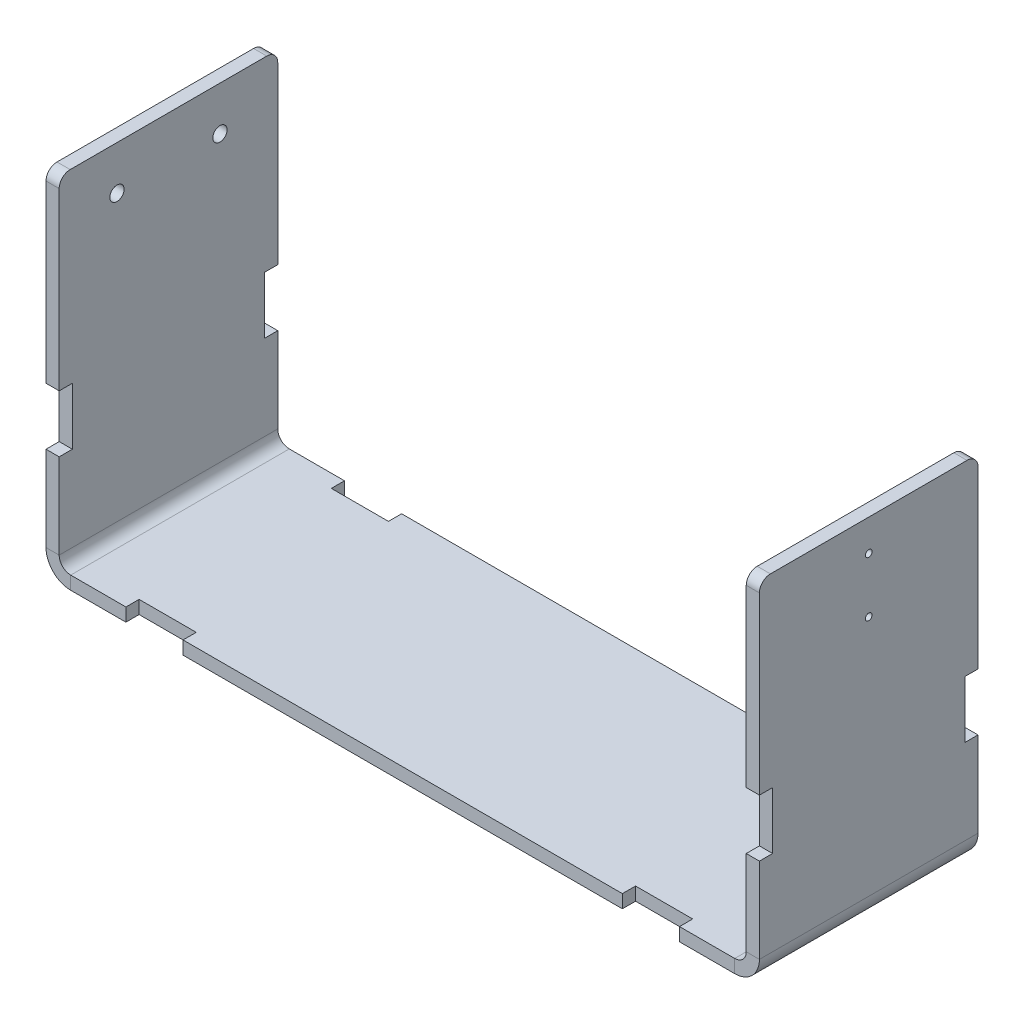
from build123d import *

# Parameters (mm, degrees)
BASE_FLANGE1_DEPTH      = 25.273
CUT_EXTRUDE1_DEPTH      = 117.714472655
CUT_EXTRUDE1_DEPTH_BACK = 117.714472655
SKETCH6_W               = 13.208
SKETCH6_H               = 3.048
CUT_EXTRUDE2_DEPTH      = 182.766885422
CUT_EXTRUDE2_DEPTH_BACK = 182.766885422
SKETCH7_W               = 3.048
SKETCH7_H               = 13.208
FILLET1_R               = 2.54
SKETCH8_R               = 0.7747
CUT_EXTRUDE3_DEPTH      = 182.766885422
CUT_EXTRUDE5_REACH      = 186.487
SKETCH10_R              = 1.651


# Sheet-metal steps are written as plain solids
with BuildPart() as part:
    # Sketch1 → Base-Flange1 (new, symmetric)
    with BuildSketch(Plane.XY):
        with BuildLine():
            Line((79.441088515, 78.607212609), (79.441088515, 2.667))
            ThreePointArc((79.441088515, 2.667), (78.6599423, 0.781146215), (76.774088515, 0))
            Line((76.774088515, 0), (-76.774088515, 0))
            ThreePointArc((-76.774088515, 0), (-78.6599423, 0.781146215), (-79.441088515, 2.667))
            Line((-79.441088515, 2.667), (-79.441088515, 78.607212609))
            Line((-79.441088515, 78.607212609), (-82.489088515, 78.607212609))
            Line((-82.489088515, 78.607212609), (-82.489088515, 2.667))
            ThreePointArc((-82.489088515, 2.667), (-80.815203769, -1.374115254), (-76.774088515, -3.048))
            Line((-76.774088515, -3.048), (76.774088515, -3.048))
            ThreePointArc((76.774088515, -3.048), (80.815203769, -1.374115254), (82.489088515, 2.667))
            Line((82.489088515, 2.667), (82.489088515, 78.607212609))
            Line((82.489088515, 78.607212609), (79.441088515, 78.607212609))
        make_face()
    extrude(amount=BASE_FLANGE1_DEPTH, both=True)

    # Sketch6 → Cut-Extrude1 (cut, two sides: drawn at the far end of the back side and taken through both)
    with BuildSketch(Plane(origin=(0, 0, 0), x_dir=(1, 0, 0), z_dir=(0, 1, 0)).offset(-CUT_EXTRUDE1_DEPTH_BACK)):
        with Locations((-57.404, 23.749)):
            Rectangle(SKETCH6_W, SKETCH6_H)
        with Locations((-57.404, -23.749)):
            Rectangle(SKETCH6_W, SKETCH6_H)
        with Locations((57.404, -23.749)):
            Rectangle(SKETCH6_W, SKETCH6_H)
        with Locations((57.404, 23.749)):
            Rectangle(SKETCH6_W, SKETCH6_H)
    extrude(amount=CUT_EXTRUDE1_DEPTH + CUT_EXTRUDE1_DEPTH_BACK, mode=Mode.SUBTRACT)

    # Sketch7 → Cut-Extrude2 (cut, two sides: drawn at the far end of the back side and taken through both)
    with BuildSketch(Plane(origin=(-79.441088515, 0, 0), x_dir=(0, 0, -1), z_dir=(1, 0, 0)).offset(-CUT_EXTRUDE2_DEPTH_BACK)):
        with Locations((-23.749, 28.956)):
            Rectangle(SKETCH7_W, SKETCH7_H)
        with Locations((23.749, 28.956)):
            Rectangle(SKETCH7_W, SKETCH7_H)
    extrude(amount=CUT_EXTRUDE2_DEPTH + CUT_EXTRUDE2_DEPTH_BACK, mode=Mode.SUBTRACT)

    # Fillet1
    fillet1_edges = [part.edges().sort_by_distance(p)[0] for p in [
        (80.965088515, 78.607212609, -25.273),
        (-80.965088515, 78.607212609, -25.273),
        (80.965088515, 78.607212609, 25.273),
        (-80.965088515, 78.607212609, 25.273),
    ]]
    fillet(fillet1_edges, radius=FILLET1_R)

    # Sketch8 → Cut-Extrude3 (cut, through all)
    with BuildSketch(Plane.ZY.offset(-79.441088515)):
        with Locations(Location((0, 58.625617182, 0), (0, 0, 270))):
            Circle(SKETCH8_R)
        with Locations(Location((0, 71.325617182, 0), (0, 0, 270))):
            Circle(SKETCH8_R)
    extrude(amount=-CUT_EXTRUDE3_DEPTH, mode=Mode.SUBTRACT)

    # Sketch10 → Cut-Extrude5 (cut, up to next)
    with BuildSketch(Plane.ZY.offset(82.489088515), mode=Mode.PRIVATE) as cut_extrude5_sk1:
        with Locations(Location((11.90625, 68.447212609, 0), (0, 0, 270))):
            Circle(SKETCH10_R)
    cut_extrude5_tool1 = extrude(cut_extrude5_sk1.sketch, amount=-CUT_EXTRUDE5_REACH, mode=Mode.PRIVATE) & part.part
    # Sketch10 → Cut-Extrude5 (cut, up to next)
    with BuildSketch(Plane.ZY.offset(82.489088515), mode=Mode.PRIVATE) as cut_extrude5_sk2:
        with Locations(Location((-11.90625, 68.447212609, 0), (0, 0, 270))):
            Circle(SKETCH10_R)
    cut_extrude5_tool2 = extrude(cut_extrude5_sk2.sketch, amount=-CUT_EXTRUDE5_REACH, mode=Mode.PRIVATE) & part.part
    add(cut_extrude5_tool1.solids().sort_by_distance((-82.489089, 68.447213, 11.90625))[0], mode=Mode.SUBTRACT)
    add(cut_extrude5_tool2.solids().sort_by_distance((-82.489089, 68.447213, -11.90625))[0], mode=Mode.SUBTRACT)


solid = part.part
